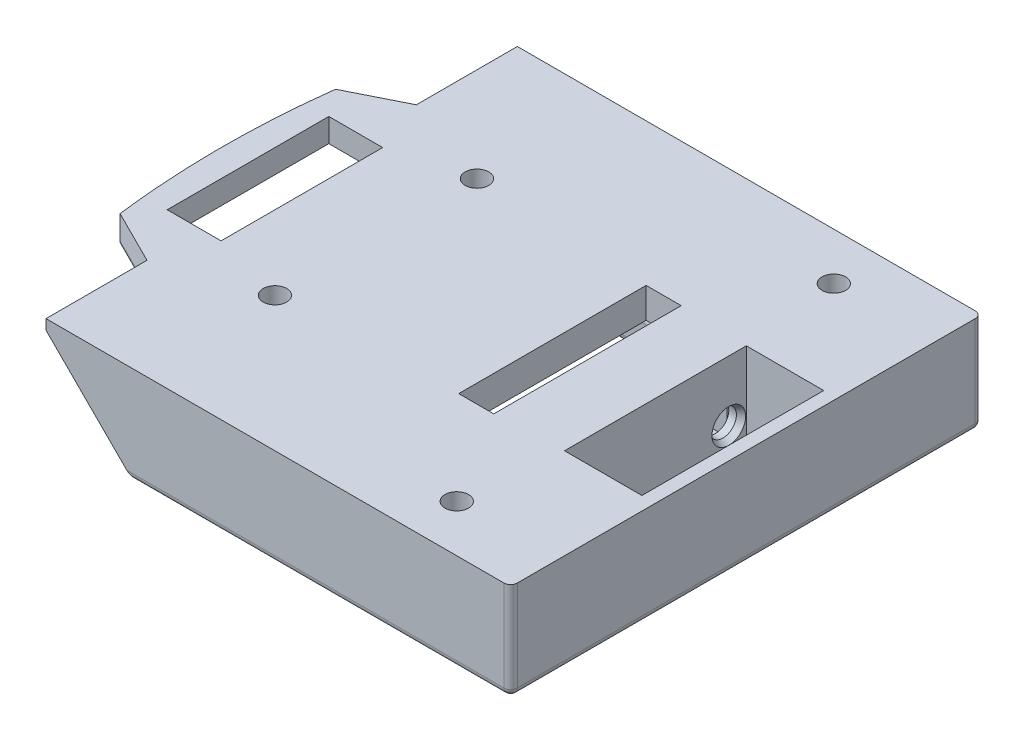
from build123d import *

# Parameters (mm, degrees)
BOSS_EXTRUDE2_DEPTH     = 5
BOSS_EXTRUDE3_DEPTH     = 5
BOSS_EXTRUDE4_DEPTH     = 4.5
CHAMFER1_SIZE           = 3
BOSS_EXTRUDE5_DEPTH     = 11.5
BOSS_EXTRUDE6_DEPTH     = 11.5
FILLET2_R               = 1
SKETCH11_W              = 8
SKETCH11_H              = 24
CUT_EXTRUDE6_DEPTH      = 67.666204955
CUT_EXTRUDE7_START      = -1
CUT_EXTRUDE7_DEPTH      = 67.488020314
CUT_EXTRUDE8_DEPTH      = 8
FILLET3_R               = 1
CHAMFER9_SIZE           = 1
CUT_EXTRUDE9_DEPTH      = 67.666205085
CUT_EXTRUDE9_DEPTH_BACK = 67.666205085
SKETCH14_R              = 1.75
CHAMFER10_SIZE          = 2
CHAMFER8_SIZE           = 3
SKETCH16_W              = 5.209820602
SKETCH16_H              = 27.835500312
CUT_EXTRUDE10_DEPTH     = 67.666205085
CUT_EXTRUDE11_REACH     = 75.086
SKETCH17_R              = 2
CHAMFER12_SIZE          = 0.5
CHAMFER12_SIZE2         = 0.866025404


with BuildPart() as part:
    # Sketch1 → Boss-Extrude2 (new body)
    with BuildSketch(Plane(origin=(0, 0, 0), x_dir=(1, 0, 0), z_dir=(0, 1, 0))):
        Polygon((-32.851435656, 19.25), (14.148564344, 19.25), (14.148564344, 15), (-1.351435656, 15), (-1.351435656, -15), (14.148564344, -15), (14.148564344, -19.25), (-32.851435656, -19.25), (-32.851435656, -35), (22.148564344, -35), (22.148564344, 35), (-32.851435656, 35), align=None)
    extrude(amount=BOSS_EXTRUDE2_DEPTH)

    # Sketch5 → Boss-Extrude3 (add)
    with BuildSketch(Plane(origin=(0, 5, 0), x_dir=(1, 0, 0), z_dir=(0, 1, 0))):
        Polygon((-32.851435656, 35), (22.148564344, 35), (22.148564344, -35), (-32.851435656, -35), (-32.851435656, -23.5), (14.148564344, -23.5), (14.148564344, -15), (-1.351435656, -15), (-1.351435656, 15), (14.148564344, 15), (14.148564344, 23.5), (-32.851435656, 23.5), align=None)
    extrude(amount=BOSS_EXTRUDE3_DEPTH)

    # Sketch6 → Boss-Extrude4 (add)
    with BuildSketch(Plane(origin=(0, 10, 0), x_dir=(1, 0, 0), z_dir=(0, 1, 0))):
        with BuildLine():
            Line((22.148564344, 35), (-46.851435656, 35))
            Line((-46.851435656, 35), (-46.851435656, 20))
            Line((-46.851435656, 20), (-54.851435656, 16))
            add(Edge.make_bspline(
                [(-54.851435656, -16), (-56.851435656, 0), (-54.851435656, 16)],
                knots=[0, 0, 0, 1, 1, 1], degree=2))
            Line((-54.851435656, -16), (-46.851435656, -20))
            Line((-46.851435656, -20), (-46.851435656, -35))
            Line((-46.851435656, -35), (22.148564344, -35))
            Line((22.148564344, -35), (22.148564344, -23))
            Line((22.148564344, -23), (22.148564344, 23))
            Line((22.148564344, 23), (22.148564344, 35))
        make_face()
    extrude(amount=BOSS_EXTRUDE4_DEPTH)

    # Chamfer1
    chamfer1_edges = [part.edges().sort_by_distance(p)[0] for p in [
        (-46.851435656, 10, -27.5),
        (-46.851435656, 10, 27.5),
    ]]
    chamfer(chamfer1_edges, length=CHAMFER1_SIZE)

    # Sketch7 → Boss-Extrude5 (add)
    with BuildSketch(Plane.XY.offset(35)):
        Polygon((-33.851435656, 0), (-43.851435656, 10), (-32.851435656, 10), (-32.851435656, 0), align=None)
    extrude(amount=-BOSS_EXTRUDE5_DEPTH)

    # Sketch8 → Boss-Extrude6 (add)
    with BuildSketch(Plane(origin=(0, 0, -35), x_dir=(-1, 0, 0), z_dir=(0, 0, -1))):
        Polygon((43.851435656, 10), (33.851435656, 0), (32.851435656, 0), (32.851435656, 10), align=None)
    extrude(amount=-BOSS_EXTRUDE6_DEPTH)

    # Fillet2
    fillet2_edges = [part.edges().sort_by_distance(p)[0] for p in [
        (-5.851435656, 0, -35),
        (22.148564344, 0, 0),
        (-5.851435656, 0, 35),
        (-9.351435656, 0, 19.25),
        (-1.351435656, 0, 0),
        (-9.351435656, 0, -19.25),
        (22.148564344, 7.25, -35),
        (22.148564344, 7.25, 35),
        (-1.351435656, 5, 15),
        (-1.351435656, 5, -15),
        (-9.351435656, 5, 19.25),
        (-9.351435656, 5, -19.25),
    ]]
    fillet(fillet2_edges, radius=FILLET2_R)

    # Sketch11 → Cut-Extrude6 (cut, through all)
    with BuildSketch(Plane.XZ.offset(-10)):
        with Locations((-47.851435656, 0)):
            Rectangle(SKETCH11_W, SKETCH11_H)
    extrude(amount=-CUT_EXTRUDE6_DEPTH, mode=Mode.SUBTRACT)

    # Sketch12 → Cut-Extrude7 (cut, through all)
    with BuildSketch(Plane.XZ.offset(CUT_EXTRUDE7_START)):
        Polygon((8.648564344, 13.5), (20.148564344, 13.5), (20.148564344, -13.5), (8.648564344, -13.5), (8.648564344, -7), (8.648564344, 7), align=None)
    extrude(amount=-CUT_EXTRUDE7_DEPTH, mode=Mode.SUBTRACT)

    # Sketch13 → Cut-Extrude8 (cut)
    with BuildSketch(Plane.ZY.offset(1.351435656)):
        with BuildLine():
            Line((11.4, 2.171572875), (11.4, 2.25))
            Line((11.4, 2.25), (12.6, 2.25))
            Line((12.6, 2.25), (12.6, 8.75))
            Line((12.6, 8.75), (11.4, 8.75))
            Line((11.4, 8.75), (11.4, 7.5))
            Line((11.4, 7.5), (10.9, 7.5))
            ThreePointArc((10.9, 7.5), (9.052240935, 6.265366865), (9.485786438, 4.085786438))
            Line((9.485786438, 4.085786438), (11.4, 2.171572875))
        make_face()
        with BuildLine():
            Line((-12.6, 8.75), (-11.4, 8.75))
            Line((-11.4, 8.75), (-11.4, 7.5))
            Line((-11.4, 7.5), (-10.9, 7.5))
            ThreePointArc((-10.9, 7.5), (-9.052240935, 6.265366865), (-9.485786438, 4.085786438))
            Line((-9.485786438, 4.085786438), (-11.4, 2.171572875))
            Line((-11.4, 2.171572875), (-11.4, 2.25))
            Line((-11.4, 2.25), (-12.6, 2.25))
            Line((-12.6, 2.25), (-12.6, 8.75))
        make_face()
    extrude(amount=-CUT_EXTRUDE8_DEPTH, mode=Mode.SUBTRACT)

    # Fillet3
    fillet3_edges = [part.edges().sort_by_distance(p)[0] for p in [
        (-49.351435656, 10, -18.75),
        (-55.851435656, 10, 0),
        (-49.351435656, 10, 18.75),
    ]]
    fillet(fillet3_edges, radius=FILLET3_R)

    # Chamfer9
    chamfer9_edges = [part.edges().sort_by_distance(p)[0] for p in [
        (-51.851435656, 10, 0),
        (-47.851435656, 10, -12),
        (-43.851435656, 10, 0),
        (-47.851435656, 10, 12),
    ]]
    chamfer(chamfer9_edges, length=CHAMFER9_SIZE)

    # Sketch14 → Cut-Extrude9 (cut, two sides: drawn at the far end of the back side and taken through both)
    with BuildSketch(Plane.XZ.offset(-10).offset(-CUT_EXTRUDE9_DEPTH_BACK)):
        with Locations(Location((-32.851435656, 15, 0), (0, 0, 270))):
            Circle(SKETCH14_R)
        with Locations(Location((-32.851435656, -15, 0), (0, 0, 270))):
            Circle(SKETCH14_R)
        with Locations((27.148564344, -15)):
            Circle(SKETCH14_R)
        with Locations((27.148564344, 15)):
            Circle(SKETCH14_R)
        with Locations(Location((7.148564344, 28, 0), (0, 0, 270))):
            Circle(SKETCH14_R)
        with Locations(Location((7.148564344, -28, 0), (0, 0, 270))):
            Circle(SKETCH14_R)
    extrude(amount=CUT_EXTRUDE9_DEPTH + CUT_EXTRUDE9_DEPTH_BACK, mode=Mode.SUBTRACT)

    # Chamfer10
    chamfer10_edges = [part.edges().sort_by_distance(p)[0] for p in [
        (7.148564344, 0, -26.25),
        (-32.851435656, 10, -13.25),
        (7.148564344, 0, 29.75),
        (-32.851435656, 10, 16.75),
    ]]
    chamfer(chamfer10_edges, length=CHAMFER10_SIZE)

    # Chamfer8
    # the kernel refuses this chamfer: 3 mm, written as the material it takes off along each edge
    with BuildSketch(Plane(origin=(-32.851435656, -6.715048964, -19.25), x_dir=(0.9996219169112965, 0, 0.02749587661058676), z_dir=(0, 1, 0))) as chamfer8_piece_1_section:
        Polygon((CHAMFER8_SIZE * 0.999621916911, CHAMFER8_SIZE * 0.0274958766106), (-CHAMFER8_SIZE * 0.0274958766106, CHAMFER8_SIZE * 0.999621916911), (0, 0), align=None)
    chamfer8_piece_1 = extrude(amount=18.430097928, mode=Mode.PRIVATE)
    chamfer8_piece_1 = split(chamfer8_piece_1, bisect_by=Plane(origin=(-31.873507714, 5, -20.294144115), z_dir=(0, -1, 0)), keep=Keep.TOP, mode=Mode.PRIVATE)
    add(chamfer8_piece_1, mode=Mode.SUBTRACT)
    with BuildSketch(Plane(origin=(-32.851435656, -6.715048964, 19.25), x_dir=(0.9996219169112968, 0, -0.027495876610586733), z_dir=(0, 1, 0))) as chamfer8_piece_2_section:
        Polygon((CHAMFER8_SIZE * 0.999621916911, -CHAMFER8_SIZE * 0.0274958766106), (-CHAMFER8_SIZE * 0.0274958766106, -CHAMFER8_SIZE * 0.999621916911), (0, 0), align=None)
    chamfer8_piece_2 = extrude(amount=18.430097928, mode=Mode.PRIVATE)
    chamfer8_piece_2 = split(chamfer8_piece_2, bisect_by=Plane(origin=(-31.873507712, 5, 20.294144115), z_dir=(0, -1, 0)), keep=Keep.TOP, mode=Mode.PRIVATE)
    add(chamfer8_piece_2, mode=Mode.SUBTRACT)

    # Sketch16 → Cut-Extrude10 (cut, through all)
    with BuildSketch(Plane.XZ.offset(-10)):
        with Locations((-3.956345957, 0.082249844)):
            Rectangle(SKETCH16_W, SKETCH16_H)
    extrude(amount=-CUT_EXTRUDE10_DEPTH, mode=Mode.SUBTRACT)

    # Sketch17 → Cut-Extrude11 (cut, up to next)
    with BuildSketch(Plane.ZY.offset(-6.648564344), mode=Mode.PRIVATE) as cut_extrude11_sk1:
        with Locations((-10.9, 5.5)):
            Circle(SKETCH17_R)
    cut_extrude11_tool1 = extrude(cut_extrude11_sk1.sketch, amount=-CUT_EXTRUDE11_REACH, mode=Mode.PRIVATE) & part.part
    # Sketch17 → Cut-Extrude11 (cut, up to next)
    with BuildSketch(Plane.ZY.offset(-6.648564344), mode=Mode.PRIVATE) as cut_extrude11_sk2:
        with Locations((10.9, 5.5)):
            Circle(SKETCH17_R)
    cut_extrude11_tool2 = extrude(cut_extrude11_sk2.sketch, amount=-CUT_EXTRUDE11_REACH, mode=Mode.PRIVATE) & part.part
    add(cut_extrude11_tool1.solids().sort_by_distance((6.648564, 5.5, -10.9))[0], mode=Mode.SUBTRACT)
    add(cut_extrude11_tool2.solids().sort_by_distance((6.648564, 5.5, 10.9))[0], mode=Mode.SUBTRACT)

    # Chamfer12
    chamfer12_edges = [part.edges().sort_by_distance(p)[0] for p in [
        (8.648564344, 5.5, -12.9),
        (8.648564344, 5.5, 8.9),
    ]]
    chamfer12_side = [part.faces().sort_by_distance(p)[0] for p in [
        (8.648564344, 7.91662971, 0),
    ]]
    chamfer(chamfer12_edges, length=CHAMFER12_SIZE, length2=CHAMFER12_SIZE2, reference=chamfer12_side[0])


solid = part.part
